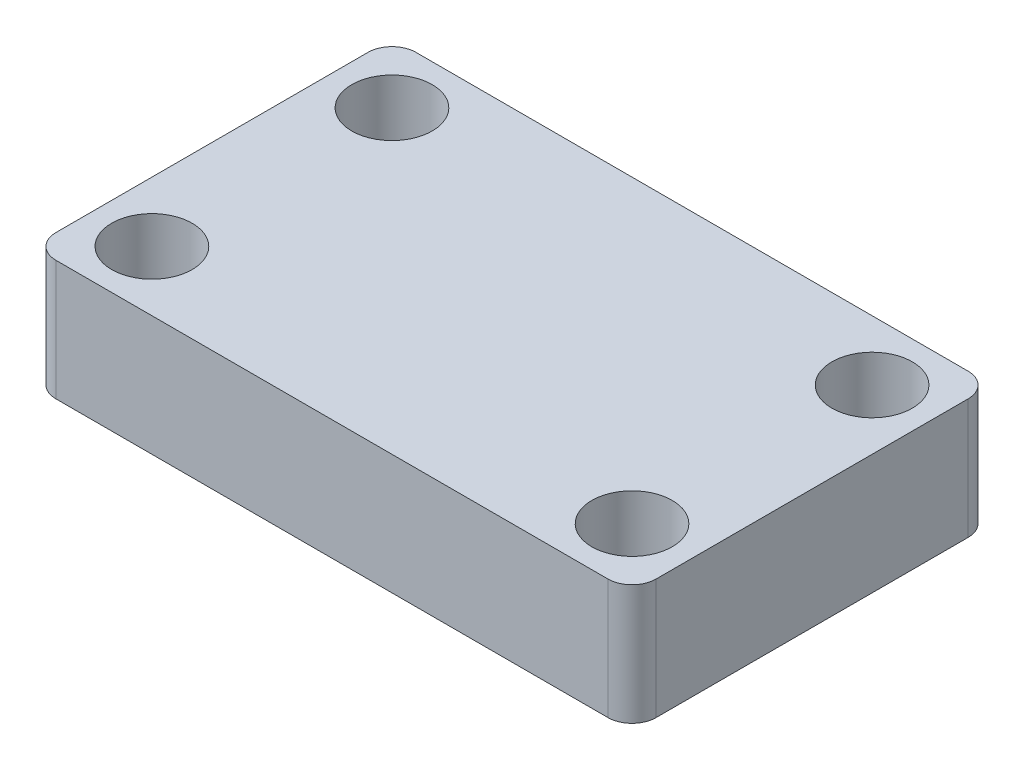
from build123d import *

# Parameters (mm, degrees)
SKETCH1_W                 = 50
SKETCH1_H                 = 30
SKETCH1_R                 = 3.35
BOSS_EXTRUDE2_DEPTH       = 10
F_8_32_TAPPED_HOLE3_D     = 3.4544
F_8_32_TAPPED_HOLE3_DEPTH = 5
F_8_32_TAPPED_HOLE3_TIP   = 1.037806461
FILLET3_R                 = 2
FILLET4_R                 = 2


with BuildPart() as part:
    # Sketch1 → Boss-Extrude2 (new body)
    with BuildSketch(Plane(origin=(0, 0, 0), x_dir=(1, 0, 0), z_dir=(0, 1, 0))):
        Rectangle(SKETCH1_W, SKETCH1_H)
        with Locations((-20, 10)):
            Circle(SKETCH1_R, mode=Mode.SUBTRACT)
        with Locations((20, 10)):
            Circle(SKETCH1_R, mode=Mode.SUBTRACT)
        with Locations((-20, -10)):
            Circle(SKETCH1_R, mode=Mode.SUBTRACT)
        with Locations((20, -10)):
            Circle(SKETCH1_R, mode=Mode.SUBTRACT)
    extrude(amount=BOSS_EXTRUDE2_DEPTH)

    # #8-32 Tapped Hole3
    with Locations(Plane(origin=(0, 5, -15), x_dir=(-1, 0, 0), z_dir=(0, 0, -1))):
        with Locations((0, 0)):
            Hole(F_8_32_TAPPED_HOLE3_D / 2, depth=F_8_32_TAPPED_HOLE3_DEPTH)
            with Locations((0, 0, -(F_8_32_TAPPED_HOLE3_DEPTH + F_8_32_TAPPED_HOLE3_TIP / 2))):  # 118° drill point
                Cone(0, F_8_32_TAPPED_HOLE3_D / 2, F_8_32_TAPPED_HOLE3_TIP, mode=Mode.SUBTRACT)

    # Fillet3
    fillet3_edges = [part.edges().sort_by_distance(p)[0] for p in [
        (-25, 5, -15),
        (25, 5, 15),
        (25, 5, -15),
    ]]
    fillet(fillet3_edges, radius=FILLET3_R)

    # Fillet4
    fillet4_edges = [part.edges().sort_by_distance(p)[0] for p in [
        (-25, 5, 15),
    ]]
    fillet(fillet4_edges, radius=FILLET4_R)


solid = part.part
